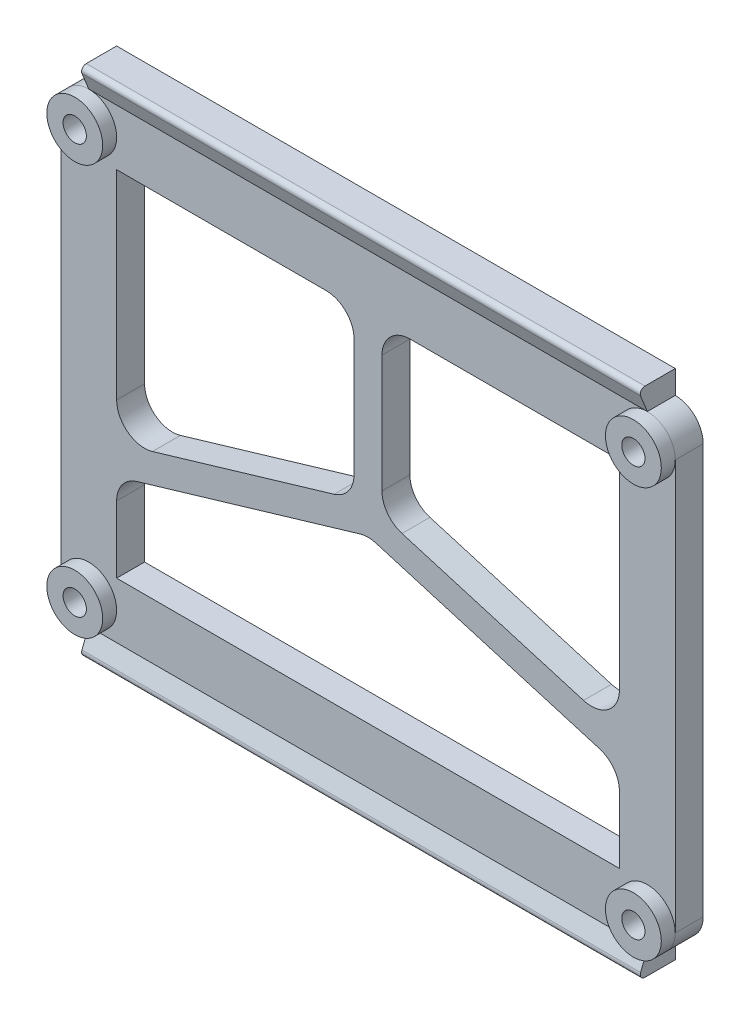
from build123d import *

# Parameters (mm, degrees)
SKETCH2_W            = 66
SKETCH2_H            = 50
BOSS_EXTRUDE1_DEPTH  = 3
SKETCH3_R            = 1.25
CUT_EXTRUDE1_DEPTH   = 3
CUT_EXTRUDE2_DEPTH   = 1.5
CUT_EXTRUDE3_DEPTH   = 42.509035161
BOSS_EXTRUDE2_START  = 1.5
SKETCH6_R            = 3
SKETCH6_R_2          = 1.25
BOSS_EXTRUDE2_DEPTH  = 1.5
FILLET1_R            = 3
BOSS_EXTRUDE3_DEPTH  = 30
FILLET2_R            = 0.5
FILLET2_OF_MIRROR1_R = 0.5


with BuildPart() as part:
    # Sketch2 → Boss-Extrude1 (new body)
    with BuildSketch(Plane.XY):
        Rectangle(SKETCH2_W, SKETCH2_H)
    extrude(amount=BOSS_EXTRUDE1_DEPTH)

    # Sketch3 → Cut-Extrude1 (cut)
    with BuildSketch(Plane.XY.offset(3)):
        with Locations((-30, 22)):
            Circle(SKETCH3_R)
        with Locations((30, 22)):
            Circle(SKETCH3_R)
        with Locations((30, -22)):
            Circle(SKETCH3_R)
        with Locations((-30, -22)):
            Circle(SKETCH3_R)
    extrude(amount=-CUT_EXTRUDE1_DEPTH, mode=Mode.SUBTRACT)

    # Sketch4 → Cut-Extrude2 (cut)
    with BuildSketch(Plane(origin=(0, 0, 0), x_dir=(-1, 0, 0), z_dir=(0, 0, -1))):
        Polygon((30, 24.424871131), (32.1, 23.212435565), (32.1, 20.787564435), (30, 19.575128869), (27.9, 20.787564435), (27.9, 23.212435565), align=None)
        Polygon((-30, 24.424871131), (-27.9, 23.212435565), (-27.9, 20.787564435), (-30, 19.575128869), (-32.1, 20.787564435), (-32.1, 23.212435565), align=None)
        Polygon((-30, -19.575128869), (-27.9, -20.787564435), (-27.9, -23.212435565), (-30, -24.424871131), (-32.1, -23.212435565), (-32.1, -20.787564435), align=None)
        Polygon((30, -19.575128869), (32.1, -20.787564435), (32.1, -23.212435565), (30, -24.424871131), (27.9, -23.212435565), (27.9, -20.787564435), align=None)
    extrude(amount=-CUT_EXTRUDE2_DEPTH, mode=Mode.SUBTRACT)

    # Sketch5 → Cut-Extrude3 (cut, through all)
    with BuildSketch(Plane(origin=(0, 0, 0), x_dir=(-1, 0, 0), z_dir=(0, 0, -1))):
        Polygon((-1.5, 1.120014204), (-1.5, 19), (-27, 19), (-27, -6.435541351), align=None)
        Polygon((27, 19), (1.5, 19), (1.5, 1.120014204), (27, -6.435541351), align=None)
        Polygon((0, -1.564458649), (-27, -9.564458649), (-27, -19), (27, -19), (27, -9.564458649), align=None)
    extrude(amount=-CUT_EXTRUDE3_DEPTH, mode=Mode.SUBTRACT)

    # Sketch6 → Boss-Extrude2 (add)
    # profile 1 of 4: a face of its own
    with BuildSketch(Plane.XY.offset(3).offset(BOSS_EXTRUDE2_START)):
        with Locations((30, 22)):
            Circle(SKETCH6_R)
        with Locations((30, 22)):
            Circle(SKETCH6_R_2, mode=Mode.SUBTRACT)
    # profile 2 of 4: a face of its own
    with BuildSketch(Plane.XY.offset(3).offset(BOSS_EXTRUDE2_START)):
        with Locations((-30, 22)):
            Circle(SKETCH6_R)
        with Locations((-30, 22)):
            Circle(SKETCH6_R_2, mode=Mode.SUBTRACT)
    # profile 3 of 4: a face of its own
    with BuildSketch(Plane.XY.offset(3).offset(BOSS_EXTRUDE2_START)):
        with Locations((-30, -22)):
            Circle(SKETCH6_R)
        with Locations((-30, -22)):
            Circle(SKETCH6_R_2, mode=Mode.SUBTRACT)
    # profile 4 of 4: a face of its own
    with BuildSketch(Plane.XY.offset(3).offset(BOSS_EXTRUDE2_START)):
        with Locations((30, -22)):
            Circle(SKETCH6_R)
        with Locations((30, -22)):
            Circle(SKETCH6_R_2, mode=Mode.SUBTRACT)
    extrude(amount=-BOSS_EXTRUDE2_DEPTH)

    # Fillet1
    fillet1_edges = [part.edges().sort_by_distance(p)[0] for p in [
        (27, -9.564458649, 1.5),
        (-27, -9.564458649, 1.5),
        (-27, -6.435541351, 1.5),
        (27, -6.435541351, 1.5),
        (0, -1.564458649, 1.5),
        (1.5, 1.120014204, 1.5),
        (-1.5, 1.120014204, 1.5),
        (1.5, 19, 1.5),
        (-1.5, 19, 1.5),
        (-33, 25, 1.5),
        (-33, -25, 1.5),
        (33, -25, 1.5),
        (33, 25, 1.5),
    ]]
    fillet(fillet1_edges, radius=FILLET1_R)

    # Sketch7 → Boss-Extrude3 (add, symmetric)
    with BuildSketch(Plane(origin=(0, 0, 0), x_dir=(0, 0, -1), z_dir=(1, 0, 0))):
        Polygon((0, 25), (0, 27.5), (-4, 27.5), (-3, 25), align=None)
    boss_extrude3 = extrude(amount=BOSS_EXTRUDE3_DEPTH, both=True)

    # Fillet2
    fillet2_edges = [part.edges().sort_by_distance(p)[0] for p in [
        (0, 27.5, 4),
    ]]
    fillet(fillet2_edges, radius=FILLET2_R)

    # Mirror1: Boss-Extrude3 across plane
    add(boss_extrude3.mirror(Plane.ZX))

    # Fillet2 of Mirror1
    fillet2_of_mirror1_edges = [part.edges().sort_by_distance(p)[0] for p in [
        (0, -27.5, 4),
    ]]
    fillet(fillet2_of_mirror1_edges, radius=FILLET2_OF_MIRROR1_R)


solid = part.part
